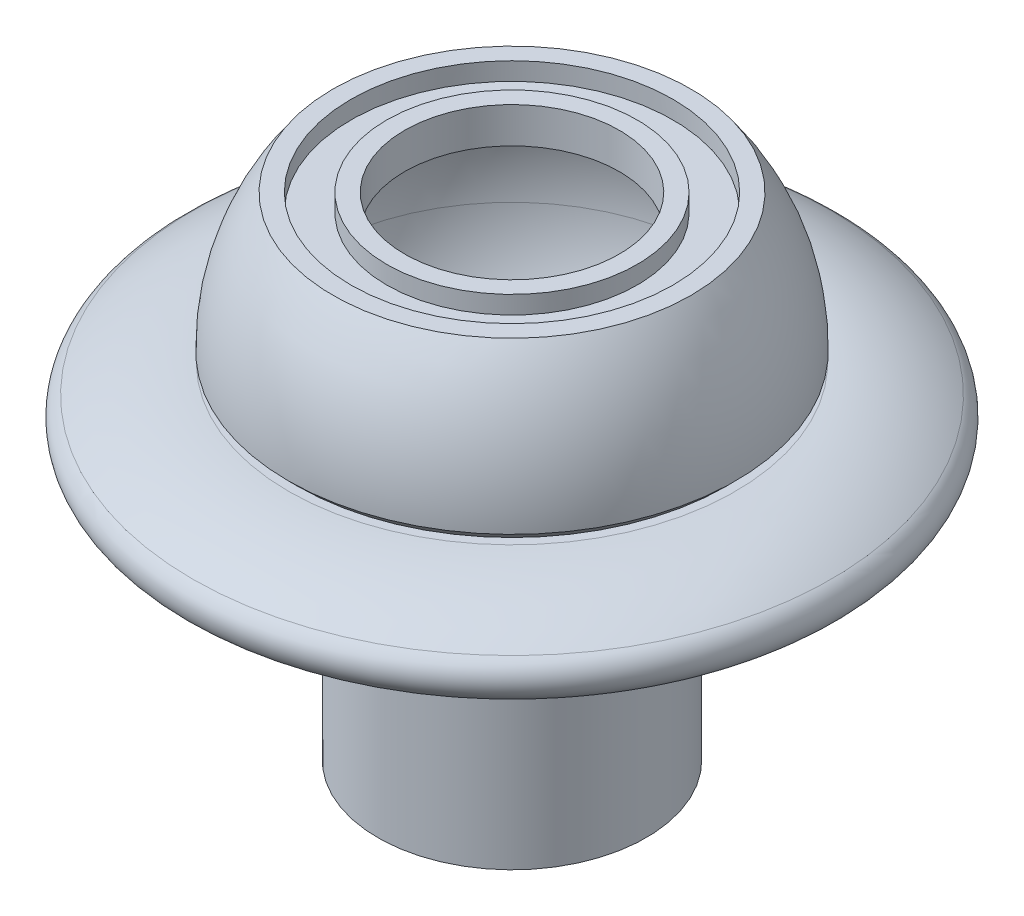
from build123d import *

# Parameters (mm, degrees)
SKETCH3_W          = 4
SKETCH3_H          = 3
SKETCH4_R          = 12
CUT_EXTRUDE1_DEPTH = 4
CHAMFER2_SIZE      = 1


with BuildPart() as part:
    # Sketch1 → Revolve1 (revolve)
    with BuildSketch(Plane.XY):
        with BuildLine():
            Line((-20, 15), (0, 15))
            Line((0, 15), (0, -40))
            Line((0, -40), (-15, -40))
            Line((-15, -40), (-15, -20))
            ThreePointArc((-15, -20), (-24.748737342, -3.535533906), (-20, 15))
        make_face()
    revolve(axis=Axis((0, 15, 0), (0, -1, 0)))

    # Shell1: read off the stored shape, not the designer's step
    # Shell1 outline → Shell1 (revolve, cut)
    with BuildSketch(Plane.XY):
        with BuildLine():
            Line((0, 11.000000019), (0, -40))
            Line((0, -40), (12, -40))
            Line((12, -40), (11.999999994, -18.439088919))
            ThreePointArc((11.999999994, -18.439088919), (21.394633494, -5.125393415), (19.052558877, 11.000000009))
            Line((19.052558877, 11.000000009), (0, 11.000000019))
        make_face()
    revolve(axis=Axis((0, 0, 0), (0, 1, 0)), mode=Mode.SUBTRACT)

    # Sketch2 → Revolve2 (revolve)
    with BuildSketch(Plane.XY, mode=Mode.PRIVATE) as revolve2_sk:
        with BuildLine():
            ThreePointArc((35.68574149, -4.627695861), (30.543499117, -2.297951073), (24.955080375, -1.497986479))
            ThreePointArc((24.955080375, -1.497986479), (24.673074146, -4.029815401), (24.134875143, -6.51980075))
            ThreePointArc((24.134875143, -6.51980075), (28.749504169, -6.988842493), (33.000208426, -8.845267693))
            ThreePointArc((33.000208426, -8.845267693), (36.451760874, -8.079248309), (35.68574149, -4.627695861))
        make_face()
    revolve(revolve2_sk.sketch.rotate(Axis((0, 9.125540713, 0), (0, -1, 0)), 180), axis=Axis((0, 9.125540713, 0), (0, -1, 0)))

    # Sketch3 → Cut-Revolve1 (revolve, cut)
    with BuildSketch(Plane.XY, mode=Mode.PRIVATE) as cut_revolve1_sk:
        with Locations((-16, 14.5)):
            Rectangle(SKETCH3_W, SKETCH3_H)
    revolve(cut_revolve1_sk.sketch.rotate(Axis((0, 20.698145497, 0), (0, -1, 0)), 270), axis=Axis((0, 20.698145497, 0), (0, -1, 0)), mode=Mode.SUBTRACT)

    # Sketch4 → Cut-Extrude1 (cut)
    with BuildSketch(Plane(origin=(0, 15, 0), x_dir=(1, 0, 0), z_dir=(0, 1, 0))):
        with Locations(Location((0, 0, 0), (0, 0, 180))):
            Circle(SKETCH4_R)
    extrude(amount=-CUT_EXTRUDE1_DEPTH, mode=Mode.SUBTRACT)


with BuildPart() as body_2:
    # Split1: the piece on the far side of the plane
    add(part.part)
    split(bisect_by=Plane.ZX.offset(-1.497986479), keep=Keep.BOTTOM)


with BuildPart() as part_1:
    add(part.part)

    # Split1
    split(bisect_by=Plane.ZX.offset(-1.497986479), keep=Keep.TOP)

    # Chamfer2
    # the kernel refuses this chamfer: 1.065775672, 1 mm, written as the material it takes off along each edge
    with BuildSketch(Plane(origin=(0, -1.497986479, 0), x_dir=(-1, 0, 0), z_dir=(0, 0, 1))) as chamfer2_piece_1:
        with BuildLine():
            Line((24.995818122, -1.040737747), (24.955080375 - CHAMFER2_SIZE, 0))
            Line((24.955080375 - CHAMFER2_SIZE, 0), (24.955080375, 0))
            ThreePointArc((24.955080375, 0), (24.981476681, -0.535789595), (24.995818122, -1.040737747))
        make_face()
    revolve(axis=Axis((0, -1.497986479, 0), (0, -1, 0)), mode=Mode.SUBTRACT)


solid = Compound([body_2.part, part_1.part])
